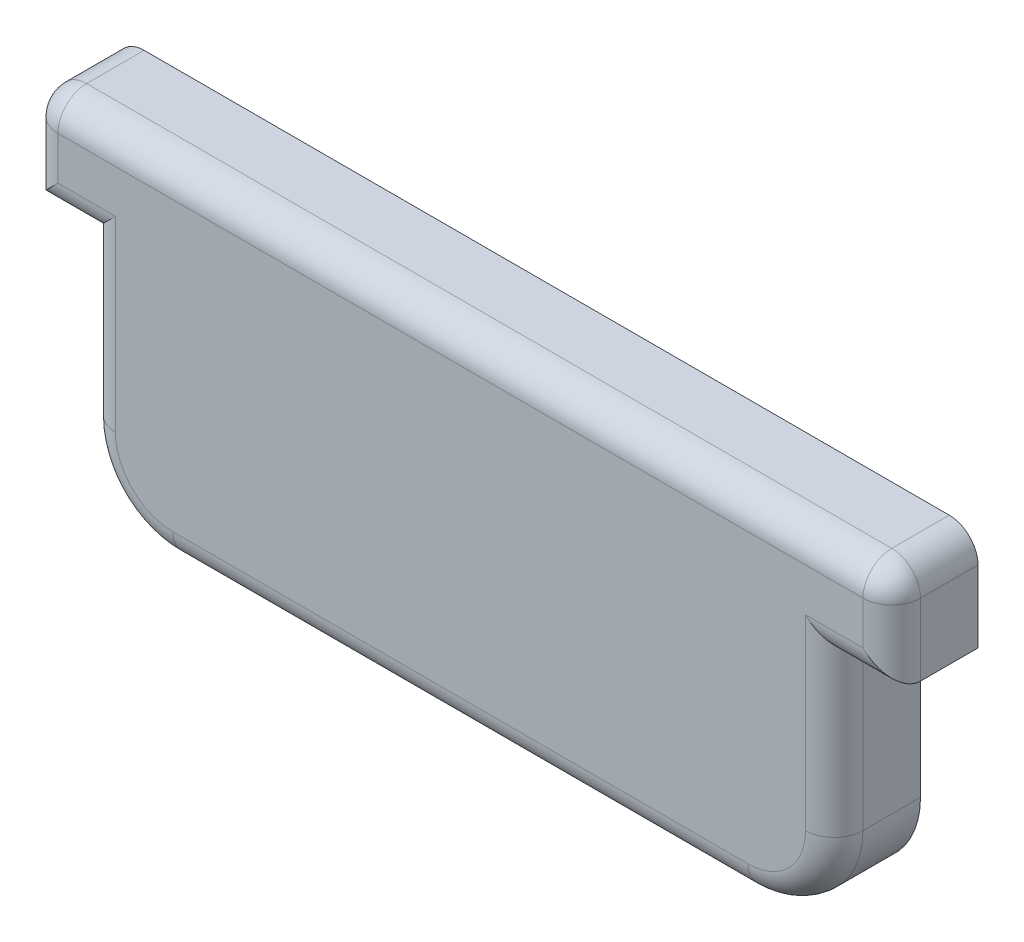
from build123d import *

# Parameters (mm, degrees)
BOSS_EXTRUDE2_DEPTH = 10
BOSS_EXTRUDE3_DEPTH = 5
FILLET1_R           = 10
SKETCH3_W           = 150
SKETCH3_H           = 15
BOSS_EXTRUDE4_DEPTH = 17.5
SKETCH5_W           = 51
SKETCH5_H           = 14.230744396
CUT_EXTRUDE1_DEPTH  = 3
FILLET2_R           = 5


with BuildPart() as part:
    # Sketch1 → Boss-Extrude2 (new body)
    with BuildSketch(Plane.XY):
        with BuildLine():
            Line((40, 52.5), (40, 80))
            Line((40, 80), (45, 80))
            Line((45, 80), (45, 52.5))
            ThreePointArc((45, 52.5), (40.606601718, 41.893398282), (30, 37.5))
            Line((30, 37.5), (-70, 37.5))
            ThreePointArc((-70, 37.5), (-80.606601718, 41.893398282), (-85, 52.5))
            Line((-85, 52.5), (-85, 80))
            Line((-85, 80), (-80, 80))
            Line((-80, 80), (-80, 52.5))
            ThreePointArc((-80, 52.5), (-77.071067812, 45.428932188), (-70, 42.5))
            Line((-70, 42.5), (30, 42.5))
            ThreePointArc((30, 42.5), (37.071067812, 45.428932188), (40, 52.5))
        make_face()
    extrude(amount=BOSS_EXTRUDE2_DEPTH)

    # Sketch2 → Boss-Extrude3 (add)
    with BuildSketch(Plane.XY.offset(10)):
        with BuildLine():
            Line((45, 52.5), (45, 80))
            Line((45, 80), (-85, 80))
            Line((-85, 80), (-85, 52.5))
            ThreePointArc((-85, 52.5), (-80.606601718, 41.893398282), (-70, 37.5))
            Line((-70, 37.5), (30, 37.5))
            ThreePointArc((30, 37.5), (40.606601718, 41.893398282), (45, 52.5))
        make_face()
    extrude(amount=BOSS_EXTRUDE3_DEPTH)

    # Fillet1
    fillet1_edges = [part.edges().sort_by_distance(p)[0] for p in [
        (-80, 66.25, 10),
        (-77.071067812, 45.428932188, 10),
        (-20, 42.5, 10),
        (37.071067812, 45.428932188, 10),
        (40, 66.25, 10),
    ]]
    fillet(fillet1_edges, radius=FILLET1_R - 0.0001)  # a hair under: the kernel refuses the full size

    # Sketch3 → Boss-Extrude4 (add)
    with BuildSketch(Plane(origin=(0, 80, 0), x_dir=(1, 0, 0), z_dir=(0, 1, 0))):
        with Locations((-20, -7.5)):
            Rectangle(SKETCH3_W, SKETCH3_H)
    extrude(amount=BOSS_EXTRUDE4_DEPTH)

    # Sketch5 → Cut-Extrude1 (cut)
    with BuildSketch(Plane(origin=(0, 0, 0), x_dir=(-1, 0, 0), z_dir=(0, 0, -1))):
        with Locations((-25.5, 87.115372198)):
            Rectangle(SKETCH5_W, SKETCH5_H)
        with Locations((65.5, 87.115372198)):
            Rectangle(SKETCH5_W, SKETCH5_H)
    extrude(amount=-CUT_EXTRUDE1_DEPTH, mode=Mode.SUBTRACT)

    # Fillet2
    fillet2_edges = [part.edges().sort_by_distance(p)[0] for p in [
        (-20, 37.5, 15),
        (-80.606601718, 41.893398282, 15),
        (-85, 66.25, 15),
        (-90, 80, 15),
        (-95, 88.75, 15),
        (-20, 97.5, 15),
        (55, 88.75, 15),
        (50, 80, 15),
        (45, 66.25, 15),
        (40.606601718, 41.893398282, 15),
        (-95, 97.5, 7.5),
        (55, 97.5, 7.5),
    ]]
    fillet(fillet2_edges, radius=FILLET2_R)


solid = part.part
